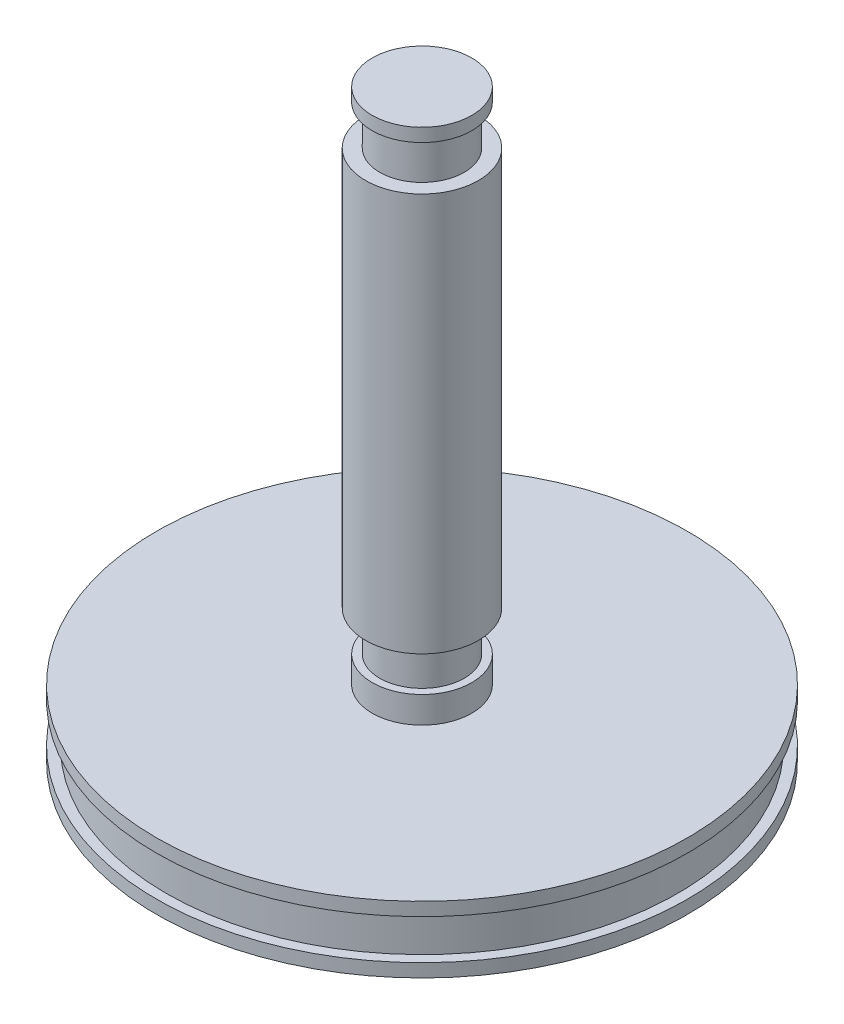
from build123d import *

# Parameters (mm, degrees)
SKETCH1_R           = 38.515
BOSS_EXTRUDE1_DEPTH = 10
SKETCH2_R           = 40
BOSS_EXTRUDE2_DEPTH = 2
BOSS_EXTRUDE3_START = -2
SKETCH3_R           = 40
BOSS_EXTRUDE3_DEPTH = 2
SKETCH4_R           = 6.366
BOSS_EXTRUDE4_DEPTH = 78
SKETCH5_R           = 7.5
BOSS_EXTRUDE5_DEPTH = 2
SKETCH6_R           = 8.5
BOSS_EXTRUDE6_DEPTH = 60
BOSS_EXTRUDE7_START = 4
SKETCH7_R           = 7.5
BOSS_EXTRUDE7_DEPTH = 4


with BuildPart() as part:
    # Sketch1 → Boss-Extrude1 (new body)
    with BuildSketch(Plane(origin=(0, 0, 0), x_dir=(1, 0, 0), z_dir=(0, 1, 0))):
        Circle(SKETCH1_R)
    extrude(amount=BOSS_EXTRUDE1_DEPTH)

    # Sketch2 → Boss-Extrude2 (add)
    with BuildSketch(Plane.XZ):
        Circle(SKETCH2_R)
    extrude(amount=-BOSS_EXTRUDE2_DEPTH)

    # Sketch3 → Boss-Extrude3 (add)
    with BuildSketch(Plane(origin=(0, 10, 0), x_dir=(1, 0, 0), z_dir=(0, 1, 0)).offset(BOSS_EXTRUDE3_START)):
        Circle(SKETCH3_R)
    extrude(amount=BOSS_EXTRUDE3_DEPTH)

    # Sketch4 → Boss-Extrude4 (add)
    with BuildSketch(Plane(origin=(0, 10, 0), x_dir=(1, 0, 0), z_dir=(0, 1, 0))):
        Circle(SKETCH4_R)
    extrude(amount=BOSS_EXTRUDE4_DEPTH)

    # Sketch5 → Boss-Extrude5 (add)
    with BuildSketch(Plane(origin=(0, 88, 0), x_dir=(1, 0, 0), z_dir=(0, 1, 0))):
        Circle(SKETCH5_R)
    extrude(amount=-BOSS_EXTRUDE5_DEPTH)

    # Sketch6 → Boss-Extrude6 (add)
    with BuildSketch(Plane(origin=(0, 80, 0), x_dir=(-1, 0, 0), z_dir=(0, -1, 0))):
        Circle(SKETCH6_R)
    extrude(amount=BOSS_EXTRUDE6_DEPTH)

    # Sketch7 → Boss-Extrude7 (add)
    with BuildSketch(Plane(origin=(0, 10, 0), x_dir=(1, 0, 0), z_dir=(0, 1, 0)).offset(BOSS_EXTRUDE7_START)):
        Circle(SKETCH7_R)
    extrude(amount=-BOSS_EXTRUDE7_DEPTH)


solid = part.part
